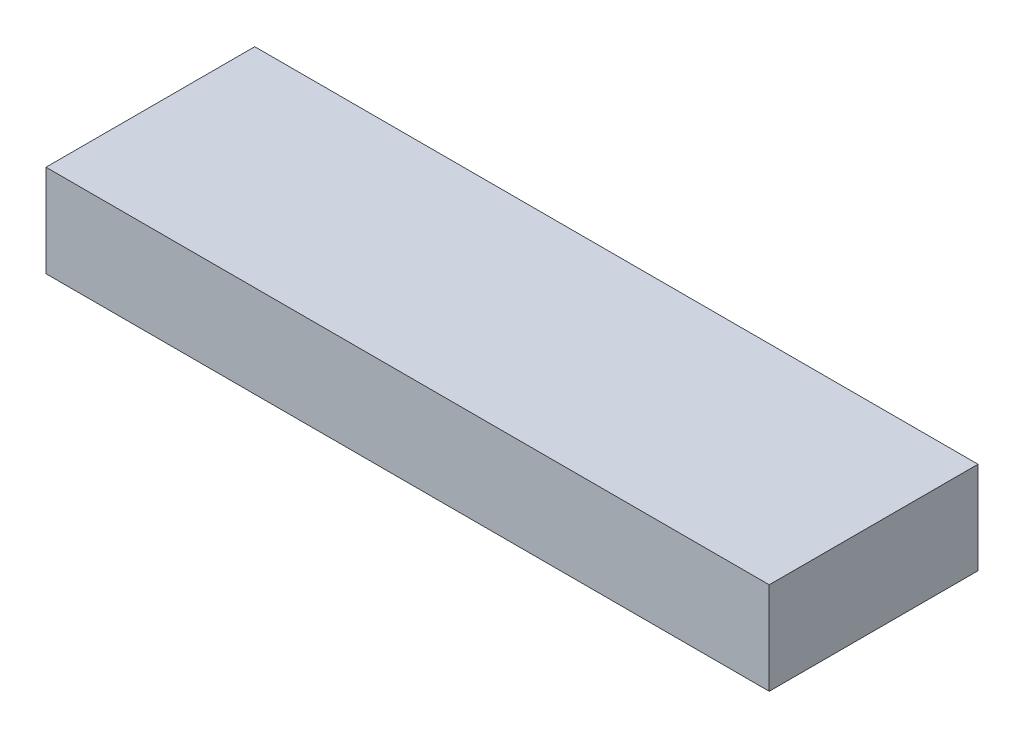
from build123d import *

# Parameters (mm, degrees)
CROQUIS1_W              = 22
CROQUIS1_H              = 6.35
SALIENTE_EXTRUIR1_DEPTH = 2.8067
CROQUIS2_W              = 2.5
CROQUIS2_H              = 0.224358974
SALIENTE_EXTRUIR2_DEPTH = 1.07696
SALIENTE_EXTRUIR2_TAPER = 3
REDONDEO1_R             = 0.049609375
CORTAR_EXTRUIR1_DEPTH   = 13.798873245


with BuildPart() as part:
    # Croquis1 → Saliente-Extruir1 (new body)
    with BuildSketch(Plane(origin=(0, 0, 0), x_dir=(1, 0, 0), z_dir=(0, 1, 0))):
        Rectangle(CROQUIS1_W, CROQUIS1_H)
    extrude(amount=SALIENTE_EXTRUIR1_DEPTH)

    # Croquis2 → Saliente-Extruir2 (add)
    with BuildSketch(Plane.ZY.offset(11)):
        with Locations((0, 1.397)):
            Rectangle(CROQUIS2_W, CROQUIS2_H)
    extrude(amount=SALIENTE_EXTRUIR2_DEPTH, taper=SALIENTE_EXTRUIR2_TAPER)

    # Chaflán1: read off the stored shape, not the designer's step
    # Chaflán1: loft between two sections, ruled curve by curve
    chafl_n1_from = [
        Edge.make_line((-12.07696, 1.34070485, -1.194115663), (-12.07696, 1.34070485, 1.194115663)),
        Edge.make_line((-12.07696, 1.34070485, 1.194115663), (-12.07696, 1.45329515, 1.194115663)),
        Edge.make_line((-12.07696, 1.34070485, -1.194115663), (-12.07696, 1.45329515, -1.194115663)),
        Edge.make_line((-12.07696, 1.45329515, 1.194115663), (-12.07696, 1.45329515, -1.194115663)),
    ]
    chafl_n1_to = [
        Edge.make_line((-11, 0.718921704, -1.815898809), (-11, 0.718921704, 1.815898809)),
        Edge.make_line((-11, 0.718921704, 1.815898809), (-11, 2.075078296, 1.815898809)),
        Edge.make_line((-11, 0.718921704, -1.815898809), (-11, 2.075078296, -1.815898809)),
        Edge.make_line((-11, 2.075078296, 1.815898809), (-11, 2.075078296, -1.815898809)),
    ]
    chafl_n1 = Solid(Shell([*[Face.make_surface_from_curves(chafl_n1_from[k], chafl_n1_to[k]) for k in range(4)], Face(Wire(chafl_n1_from)), Face(Wire(chafl_n1_to))]))
    add(chafl_n1)

    # Redondeo1
    redondeo1_edges = [part.edges().sort_by_distance(p)[0] for p in [
        (-11.53848, 1.029813277, 1.505007236),
        (-11.53848, 1.029813277, -1.505007236),
        (-11.53848, 1.764186723, 1.505007236),
        (-11.53848, 1.764186723, -1.505007236),
    ]]
    fillet(redondeo1_edges, radius=REDONDEO1_R)

    # Croquis4 → Cortar-Extruir1 (cut, through all)
    with BuildSketch(Plane.XZ):
        with BuildLine():
            Line((-12.07696, -1.194115663), (-12.07696, 1.194115663))
            ThreePointArc((-12.07696, 1.194115663), (-11.963672899, 0), (-12.07696, -1.194115663))
        make_face()
    extrude(amount=-CORTAR_EXTRUIR1_DEPTH, mode=Mode.SUBTRACT)


solid = part.part
